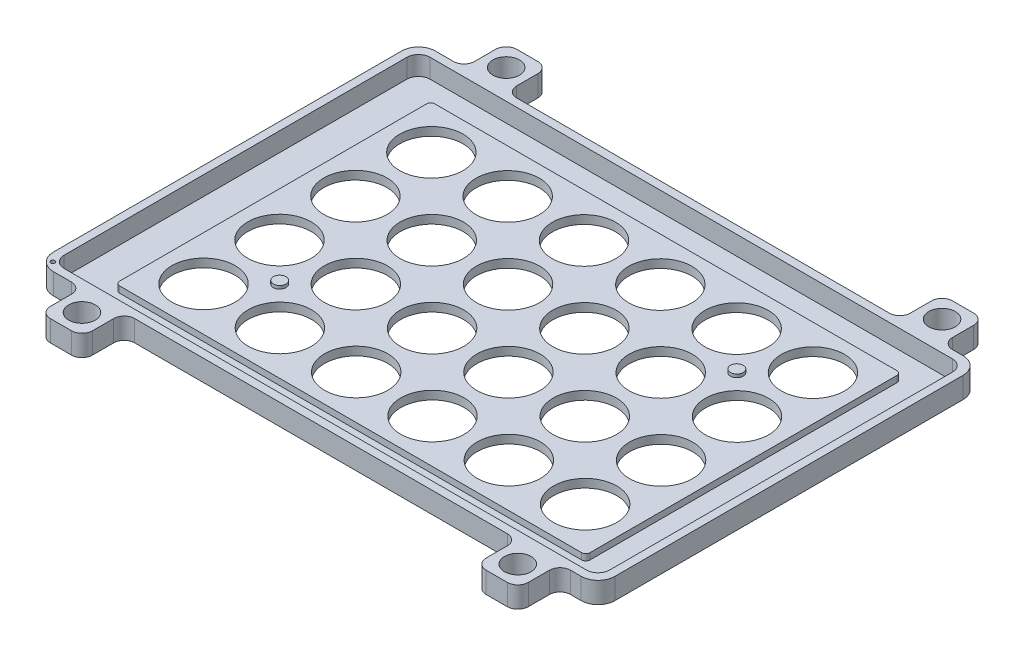
from build123d import *

# Parameters (mm, degrees)
SKETCH1_W           = 157.864
SKETCH1_H           = 90.551
BOSS_EXTRUDE1_DEPTH = 5
SKETCH7_R           = 7.5
CUT_EXTRUDE5_DEPTH  = 183.059128024
SKETCH23_W          = 129.2861173
SKETCH23_H          = 86.72376579
SKETCH23_W_2        = 111.4861173
SKETCH23_H_2        = 74.72376579
CUT_EXTRUDE21_DEPTH = 4.5
FILLET7_R           = 1
FILLET8_R           = 2.75
SKETCH26_W          = 116.5861173
SKETCH26_H          = 74.72376579
CUT_EXTRUDE22_DEPTH = 3
SKETCH29_W          = 12.37533
SKETCH29_H          = 90.551
CUT_EXTRUDE25_DEPTH = 183.059128024
FILLET9_R           = 4
SKETCH30_W          = 10
SKETCH30_H          = 10
BOSS_EXTRUDE2_DEPTH = 5
SKETCH31_R          = 3.15
CUT_EXTRUDE26_DEPTH = 177.925003036
FILLET10_R          = 2.5
SKETCH35_R          = 1.5
BOSS_EXTRUDE3_DEPTH = 0.75
SKETCH37_R          = 0.5
CUT_EXTRUDE29_DEPTH = 1


with BuildPart() as part:
    # Sketch1 → Boss-Extrude1 (new body)
    with BuildSketch(Plane(origin=(0, 0, 0), x_dir=(1, 0, 0), z_dir=(0, 1, 0))):
        with Locations((78.932, -45.2755)):
            Rectangle(SKETCH1_W, SKETCH1_H)
    extrude(amount=BOSS_EXTRUDE1_DEPTH)

    # Sketch7 → Cut-Extrude5 (cut, through all)
    with BuildSketch(Plane.XZ):
        with Locations((33.707, 72.2755)):
            Circle(SKETCH7_R)
        with Locations((51.797, 72.2755)):
            Circle(SKETCH7_R)
        with Locations((69.887, 72.2755)):
            Circle(SKETCH7_R)
        with Locations((87.977, 72.2755)):
            Circle(SKETCH7_R)
        with Locations((106.067, 72.2755)):
            Circle(SKETCH7_R)
        with Locations((124.157, 72.2755)):
            Circle(SKETCH7_R)
        with Locations((51.797, 54.2755)):
            Circle(SKETCH7_R)
        with Locations((69.887, 54.2755)):
            Circle(SKETCH7_R)
        with Locations((87.977, 54.2755)):
            Circle(SKETCH7_R)
        with Locations((106.067, 54.2755)):
            Circle(SKETCH7_R)
        with Locations((124.157, 54.2755)):
            Circle(SKETCH7_R)
        with Locations((51.797, 36.2755)):
            Circle(SKETCH7_R)
        with Locations((69.887, 36.2755)):
            Circle(SKETCH7_R)
        with Locations((87.977, 36.2755)):
            Circle(SKETCH7_R)
        with Locations((106.067, 36.2755)):
            Circle(SKETCH7_R)
        with Locations((124.157, 36.2755)):
            Circle(SKETCH7_R)
        with Locations((51.797, 18.2755)):
            Circle(SKETCH7_R)
        with Locations((69.887, 18.2755)):
            Circle(SKETCH7_R)
        with Locations((87.977, 18.2755)):
            Circle(SKETCH7_R)
        with Locations((106.067, 18.2755)):
            Circle(SKETCH7_R)
        with Locations((124.157, 18.2755)):
            Circle(SKETCH7_R)
        with Locations((33.707, 54.2755)):
            Circle(SKETCH7_R)
        with Locations((33.707, 36.2755)):
            Circle(SKETCH7_R)
        with Locations((33.707, 18.2755)):
            Circle(SKETCH7_R)
    extrude(amount=-CUT_EXTRUDE5_DEPTH, mode=Mode.SUBTRACT)

    # Sketch23 → Cut-Extrude21 (cut)
    with BuildSketch(Plane(origin=(0, 5, 0), x_dir=(1, 0, 0), z_dir=(0, 1, 0))):
        with Locations((78.93200135, -45.2755)):
            Rectangle(SKETCH23_W, SKETCH23_H)
        with Locations((78.93200135, -45.2755)):
            Rectangle(SKETCH23_W_2, SKETCH23_H_2, mode=Mode.SUBTRACT)
    extrude(amount=-CUT_EXTRUDE21_DEPTH, mode=Mode.SUBTRACT)

    # Fillet7
    fillet7_edges = [part.edges().sort_by_distance(p)[0] for p in [
        (134.67506, 2.75, 7.913617105),
        (23.1889427, 2.75, 7.913617105),
        (23.1889427, 2.75, 82.637382895),
        (134.67506, 2.75, 82.637382895),
    ]]
    fillet(fillet7_edges, radius=FILLET7_R)

    # Fillet8
    fillet8_edges = [part.edges().sort_by_distance(p)[0] for p in [
        (143.57506, 2.75, 1.913617105),
        (14.2889427, 2.75, 1.913617105),
        (14.2889427, 2.75, 88.637382895),
        (143.57506, 2.75, 88.637382895),
    ]]
    fillet(fillet8_edges, radius=FILLET8_R)

    # Sketch26 → Cut-Extrude22 (cut)
    with BuildSketch(Plane(origin=(0, 5, 0), x_dir=(1, 0, 0), z_dir=(0, 1, 0))):
        with Locations((76.38200135, -45.2755)):
            Rectangle(SKETCH26_W, SKETCH26_H)
    extrude(amount=-CUT_EXTRUDE22_DEPTH, mode=Mode.SUBTRACT)

    # Sketch29 → Cut-Extrude25 (cut, through all)
    with BuildSketch(Plane(origin=(0, 5, 0), x_dir=(1, 0, 0), z_dir=(0, 1, 0))):
        with Locations((151.676335, -45.2755)):
            Rectangle(SKETCH29_W, SKETCH29_H)
        with Locations((6.187665, -45.2755)):
            Rectangle(SKETCH29_W, SKETCH29_H)
    extrude(amount=-CUT_EXTRUDE25_DEPTH, mode=Mode.SUBTRACT)

    # Fillet9
    fillet9_edges = [part.edges().sort_by_distance(p)[0] for p in [
        (12.37533, 2.5, 90.551),
        (145.48867, 2.5, 90.551),
        (145.48867, 2.5, 0),
        (12.37533, 2.5, 0),
    ]]
    fillet(fillet9_edges, radius=FILLET9_R)

    # Sketch30 → Boss-Extrude2 (add)
    with BuildSketch(Plane.XZ):
        with Locations((131.4704, -5)):
            Rectangle(SKETCH30_W, SKETCH30_H)
        with Locations((28.1704, -5)):
            Rectangle(SKETCH30_W, SKETCH30_H)
        with Locations((131.4704, 95.551)):
            Rectangle(SKETCH30_W, SKETCH30_H)
        with Locations((28.1704, 95.551)):
            Rectangle(SKETCH30_W, SKETCH30_H)
    extrude(amount=-BOSS_EXTRUDE2_DEPTH)

    # Sketch31 → Cut-Extrude26 (cut, through all)
    with BuildSketch(Plane(origin=(0, 5, 0), x_dir=(1, 0, 0), z_dir=(0, 1, 0))):
        with Locations((28.1704, 5)):
            Circle(SKETCH31_R)
        with Locations((131.4704, 5)):
            Circle(SKETCH31_R)
        with Locations((28.1704, -95.551)):
            Circle(SKETCH31_R)
        with Locations((131.4704, -95.551)):
            Circle(SKETCH31_R)
    extrude(amount=-CUT_EXTRUDE26_DEPTH, mode=Mode.SUBTRACT)

    # Fillet10
    fillet10_edges = [part.edges().sort_by_distance(p)[0] for p in [
        (23.1704, 2.5, 100.551),
        (126.4704, 2.5, 100.551),
        (33.1704, 2.5, 100.551),
        (136.4704, 2.5, 100.551),
        (136.4704, 2.5, -10),
        (126.4704, 2.5, -10),
        (33.1704, 2.5, -10),
        (23.1704, 2.5, -10),
        (23.1704, 2.5, 90.551),
        (33.1704, 2.5, 90.551),
        (126.4704, 2.5, 90.551),
        (136.4704, 2.5, 90.551),
        (136.4704, 2.5, 0),
        (126.4704, 2.5, 0),
        (33.1704, 2.5, 0),
        (23.1704, 2.5, 0),
    ]]
    fillet(fillet10_edges, radius=FILLET10_R)

    # Sketch35 → Boss-Extrude3 (add)
    with BuildSketch(Plane(origin=(0, 2, 0), x_dir=(1, 0, 0), z_dir=(0, 1, 0))):
        with Locations((115.112, -27.2755)):
            Circle(SKETCH35_R)
        with Locations((42.752, -63.2755)):
            Circle(SKETCH35_R)
    extrude(amount=BOSS_EXTRUDE3_DEPTH)

    # Sketch37 → Cut-Extrude29 (cut)
    with BuildSketch(Plane(origin=(0, 5, 0), x_dir=(1, 0, 0), z_dir=(0, 1, 0))):
        with Locations((14.320649862, -88.605675733)):
            Circle(SKETCH37_R)
    extrude(amount=-CUT_EXTRUDE29_DEPTH, mode=Mode.SUBTRACT)


solid = part.part
